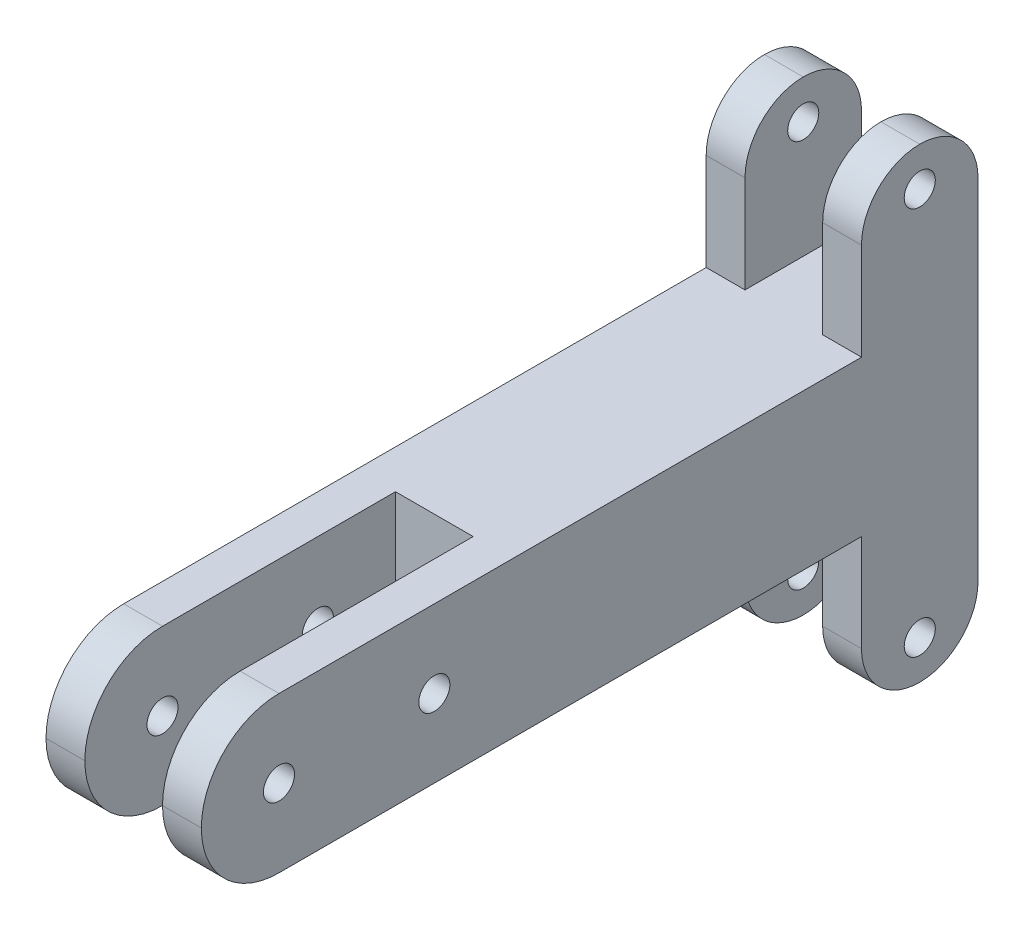
from build123d import *

# Parameters (mm, degrees)
SKETCH1_W           = 20
SKETCH1_H           = 100
BOSS_EXTRUDE1_DEPTH = 20
SKETCH2_W           = 10
SKETCH2_H           = 40
CUT_EXTRUDE1_DEPTH  = 55.772255751
SKETCH3_R           = 2
CUT_EXTRUDE2_DEPTH  = 58.445626465
FILLET1_R           = 10
SKETCH4_W           = 20
SKETCH4_H           = 15
BOSS_EXTRUDE2_DEPTH = 20
SKETCH5_R           = 2
CUT_EXTRUDE3_DEPTH  = 68.082039325
CUT_EXTRUDE4_REACH  = 110.167
SKETCH6_W           = 10
SKETCH6_H           = 20
FILLET2_R           = 7.5


with BuildPart() as part:
    # Sketch1 → Boss-Extrude1 (new body)
    with BuildSketch(Plane(origin=(0, 0, 0), x_dir=(1, 0, 0), z_dir=(0, 1, 0))):
        Rectangle(SKETCH1_W, SKETCH1_H)
    extrude(amount=BOSS_EXTRUDE1_DEPTH)

    # Sketch2 → Cut-Extrude1 (cut, through all)
    with BuildSketch(Plane(origin=(0, 20, 0), x_dir=(1, 0, 0), z_dir=(0, 1, 0))):
        with Locations((0, -30)):
            Rectangle(SKETCH2_W, SKETCH2_H)
    extrude(amount=-CUT_EXTRUDE1_DEPTH, mode=Mode.SUBTRACT)

    # Sketch3 → Cut-Extrude2 (cut, through all)
    with BuildSketch(Plane(origin=(10, 0, 0), x_dir=(0, 0, -1), z_dir=(1, 0, 0))):
        with Locations((-40, 10)):
            Circle(SKETCH3_R)
        with Locations((-20, 10)):
            Circle(SKETCH3_R)
    extrude(amount=-CUT_EXTRUDE2_DEPTH, mode=Mode.SUBTRACT)

    # Fillet1
    fillet1_edges = [part.edges().sort_by_distance(p)[0] for p in [
        (7.5, 0, 50),
        (-7.5, 0, 50),
        (-7.5, 20, 50),
        (7.5, 20, 50),
    ]]
    fillet(fillet1_edges, radius=FILLET1_R - 0.0001)  # a hair under: the kernel refuses the full size

    # Sketch4 → Boss-Extrude2 (add)
    with BuildSketch(Plane(origin=(0, 20, 0), x_dir=(1, 0, 0), z_dir=(0, 1, 0))):
        with Locations((0, 42.5)):
            Rectangle(SKETCH4_W, SKETCH4_H)
    boss_extrude2 = extrude(amount=BOSS_EXTRUDE2_DEPTH)

    # Mirror1: Boss-Extrude2 across plane
    add(boss_extrude2.mirror(Plane.ZX.offset(10)))

    # Sketch5 → Cut-Extrude3 (cut, through all)
    with BuildSketch(Plane.ZY.offset(10)):
        with Locations((-42.5, 35)):
            Circle(SKETCH5_R)
        with Locations((-42.5, -15)):
            Circle(SKETCH5_R)
    extrude(amount=-CUT_EXTRUDE3_DEPTH, mode=Mode.SUBTRACT)

    # Sketch6 → Cut-Extrude4 (cut, up to next)
    with BuildSketch(Plane(origin=(0, 0, -50), x_dir=(-1, 0, 0), z_dir=(0, 0, -1)), mode=Mode.PRIVATE) as cut_extrude4_sk1:
        with Locations((0, 30)):
            Rectangle(SKETCH6_W, SKETCH6_H)
    cut_extrude4_tool1 = extrude(cut_extrude4_sk1.sketch, amount=-CUT_EXTRUDE4_REACH, mode=Mode.PRIVATE) & part.part
    # Sketch6 → Cut-Extrude4 (cut, up to next)
    with BuildSketch(Plane(origin=(0, 0, -50), x_dir=(-1, 0, 0), z_dir=(0, 0, -1)), mode=Mode.PRIVATE) as cut_extrude4_sk2:
        with Locations((0, -10)):
            Rectangle(SKETCH6_W, SKETCH6_H)
    cut_extrude4_tool2 = extrude(cut_extrude4_sk2.sketch, amount=-CUT_EXTRUDE4_REACH, mode=Mode.PRIVATE) & part.part
    add(cut_extrude4_tool1.solids().sort_by_distance((0, 30, -50))[0], mode=Mode.SUBTRACT)
    add(cut_extrude4_tool2.solids().sort_by_distance((0, -10, -50))[0], mode=Mode.SUBTRACT)

    # Fillet2
    fillet2_edges = [part.edges().sort_by_distance(p)[0] for p in [
        (-7.5, 40, -35),
        (-7.5, 40, -50),
        (7.5, 40, -35),
        (7.5, 40, -50),
        (7.5, -20, -35),
        (7.5, -20, -50),
        (-7.5, -20, -35),
        (-7.5, -20, -50),
    ]]
    fillet(fillet2_edges, radius=FILLET2_R - 0.0001)  # a hair under: the kernel refuses the full size


solid = part.part
